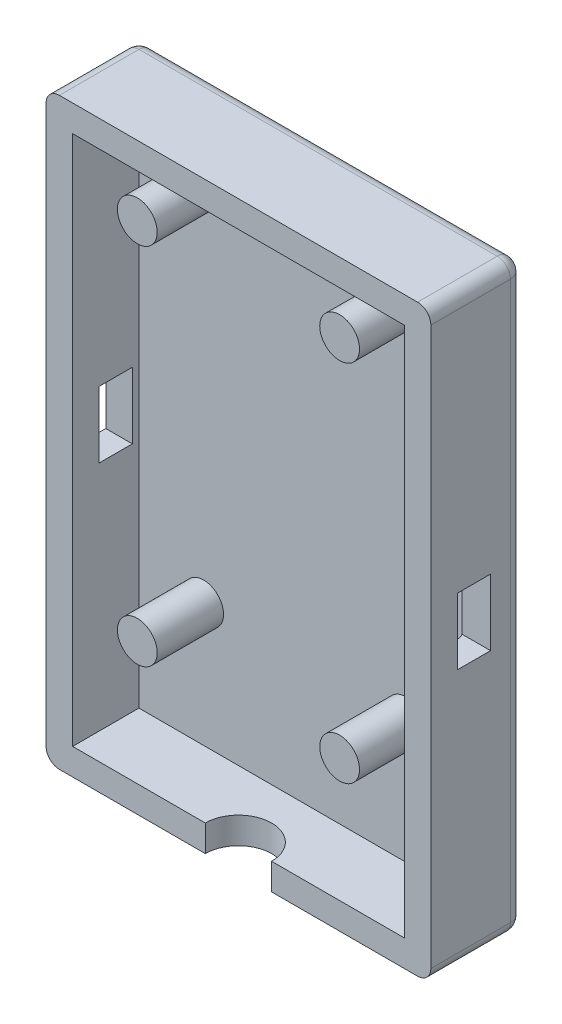
from build123d import *

# Parameters (mm, degrees)
SKETCH1_W           = 29
SKETCH1_H           = 44
BOSS_EXTRUDE1_DEPTH = 2
SKETCH2_W           = 29
SKETCH2_H           = 44
BOSS_EXTRUDE2_DEPTH = 5
CUT_EXTRUDE1_DEPTH  = 45.980551353
CUT_EXTRUDE2_DEPTH  = 39.93906297
SKETCH8_R           = 1.5
BOSS_EXTRUDE3_DEPTH = 5
FILLET1_R           = 1


with BuildPart() as part:
    # Sketch1 → Boss-Extrude1 (new body)
    with BuildSketch(Plane.XY):
        with Locations((0, 3.025)):
            Rectangle(SKETCH1_W, SKETCH1_H)
    extrude(amount=BOSS_EXTRUDE1_DEPTH)

    # Sketch2 → Boss-Extrude2 (add)
    with BuildSketch(Plane.XY.offset(2)):
        with Locations((0, 3.025)):
            Rectangle(SKETCH2_W, SKETCH2_H)
        Polygon((12.5, 23.025), (12.5, 16.975), (12.5, -16.975), (-12.5, -16.975), (-12.5, 16.975), (-12.5, 23.025), align=None, mode=Mode.SUBTRACT)
    extrude(amount=BOSS_EXTRUDE2_DEPTH)

    # Sketch4 → Cut-Extrude1 (cut, through all)
    with BuildSketch(Plane(origin=(0, -16.975, 0), x_dir=(1, 0, 0), z_dir=(0, 1, 0))):
        with BuildLine():
            Line((-2.5, -7), (2.5, -7))
            ThreePointArc((2.5, -7), (0, -4.5), (-2.5, -7))
        make_face()
    extrude(amount=-CUT_EXTRUDE1_DEPTH, mode=Mode.SUBTRACT)

    # Sketch5 → Cut-Extrude2 (cut, through all)
    with BuildSketch(Plane.ZY.offset(14.5)):
        Polygon((5, 5.525), (5, 0.525), (4.5, 0.525), (2.5, 0.525), (2.5, 5.525), (4.5, 5.525), align=None)
    extrude(amount=-CUT_EXTRUDE2_DEPTH, mode=Mode.SUBTRACT)

    # Sketch8 → Boss-Extrude3 (add)
    with BuildSketch(Plane.XY.offset(2)):
        with Locations((-7.625, 19.775)):
            Circle(SKETCH8_R)
        with Locations(Location((-7.625, -7.675, 0), (0, 0, 180))):
            Circle(SKETCH8_R)
        with Locations((7.625, -7.675)):
            Circle(SKETCH8_R)
        with Locations(Location((7.625, 19.775, 0), (0, 0, 180))):
            Circle(SKETCH8_R)
    extrude(amount=BOSS_EXTRUDE3_DEPTH)

    # Fillet1
    # the kernel refuses this fillet: 1 mm, written as the material it adds along each edge
    with BuildSketch(Plane(origin=(12.5, 23.025, 2), x_dir=(0, 0, 1), z_dir=(0, -1, 0))) as fillet1_piece_1_section:
        with BuildLine():
            CenterArc((FILLET1_R, FILLET1_R), FILLET1_R, 180, 90)
            Line((0, FILLET1_R), (0, 0))
            Line((0, 0), (FILLET1_R, 0))
        make_face()
    fillet1_piece_1 = extrude(amount=42.5, mode=Mode.PRIVATE)
    fillet1_piece_1 = split(fillet1_piece_1, bisect_by=Plane(origin=(12.460315407, 5.525, 2.623263613), z_dir=(0, 1, 0)), keep=Keep.TOP, mode=Mode.PRIVATE)
    add(fillet1_piece_1)
    with BuildSketch(Plane(origin=(12.5, 25.525, 2), x_dir=(0, 0, 1), z_dir=(0, -1, 0))) as fillet1_piece_2_section:
        with BuildLine():
            CenterArc((FILLET1_R, FILLET1_R), FILLET1_R, 180, 90)
            Line((0, FILLET1_R), (0, 0))
            Line((0, 0), (FILLET1_R, 0))
        make_face()
    fillet1_piece_2 = extrude(amount=42.5, mode=Mode.PRIVATE)
    fillet1_piece_2 = split(fillet1_piece_2, bisect_by=Plane(origin=(12.255975151, 3.025, 2.5), z_dir=(0, 0, -1)), keep=Keep.TOP, mode=Mode.PRIVATE)
    fillet1_piece_2 = split(fillet1_piece_2, bisect_by=Plane(origin=(12.255975151, 5.525, 2.17839593), z_dir=(0, -1, 0)), keep=Keep.TOP, mode=Mode.PRIVATE)
    add(fillet1_piece_2)
    with BuildSketch(Plane(origin=(12.5, 25.525, 2), x_dir=(0, 0, 1), z_dir=(0, -1, 0))) as fillet1_piece_3_section:
        with BuildLine():
            CenterArc((FILLET1_R, FILLET1_R), FILLET1_R, 180, 90)
            Line((0, FILLET1_R), (0, 0))
            Line((0, 0), (FILLET1_R, 0))
        make_face()
    fillet1_piece_3 = extrude(amount=42.5, mode=Mode.PRIVATE)
    fillet1_piece_3 = split(fillet1_piece_3, bisect_by=Plane(origin=(12.460315407, 0.525, 2.623263613), z_dir=(0, -1, 0)), keep=Keep.TOP, mode=Mode.PRIVATE)
    add(fillet1_piece_3)
    # the kernel refuses this fillet: 1 mm, written as the material it takes off along each edge
    with BuildSketch(Plane(origin=(13.5, 24.025, 1), x_dir=(0, 0, -1), z_dir=(0, 1, 0))) as fillet1_2_piece_1_section:
        Polygon((0, 0), (FILLET1_R * 1.02, 0), (FILLET1_R * 1.02, -FILLET1_R * 1.02), (0, -FILLET1_R * 1.02), align=None)
    fillet1_2_piece_1 = extrude(amount=FILLET1_R * 1.02, mode=Mode.PRIVATE)
    fillet1_2_piece_1 = fillet1_2_piece_1 - Plane(origin=(13.5, 24.025, 1), x_dir=(-0.7071067811865475, 0, 0.7071067811865475), z_dir=(0, 1, 0)) * Sphere(FILLET1_R, mode=Mode.PRIVATE)
    add(fillet1_2_piece_1, mode=Mode.SUBTRACT)
    with BuildSketch(Plane(origin=(13.5, -17.975, 1), x_dir=(1, 0, 0), z_dir=(0, 0, -1))) as fillet1_2_piece_2_section:
        Polygon((0, 0), (FILLET1_R * 1.02, 0), (FILLET1_R * 1.02, FILLET1_R * 1.02), (0, FILLET1_R * 1.02), align=None)
    fillet1_2_piece_2 = extrude(amount=FILLET1_R * 1.02, mode=Mode.PRIVATE)
    fillet1_2_piece_2 = fillet1_2_piece_2 - Plane(origin=(13.5, -17.975, 1), x_dir=(-0.7071067811865476, 0.7071067811865475, 0), z_dir=(0, 0, -1)) * Sphere(FILLET1_R, mode=Mode.PRIVATE)
    add(fillet1_2_piece_2, mode=Mode.SUBTRACT)
    with BuildSketch(Plane(origin=(-13.5, -17.975, 1), x_dir=(0, -1, 0), z_dir=(0, 0, -1))) as fillet1_2_piece_3_section:
        Polygon((0, 0), (FILLET1_R * 1.02, 0), (FILLET1_R * 1.02, FILLET1_R * 1.02), (0, FILLET1_R * 1.02), align=None)
    fillet1_2_piece_3 = extrude(amount=FILLET1_R * 1.02, mode=Mode.PRIVATE)
    fillet1_2_piece_3 = fillet1_2_piece_3 - Plane(origin=(-13.5, -17.975, 1), x_dir=(0.7071067811865475, 0.7071067811865477, 0), z_dir=(0, 0, -1)) * Sphere(FILLET1_R, mode=Mode.PRIVATE)
    add(fillet1_2_piece_3, mode=Mode.SUBTRACT)
    with BuildSketch(Plane(origin=(-13.5, 24.025, 1), x_dir=(0, 0, -1), z_dir=(0, 1, 0))) as fillet1_2_piece_4_section:
        Polygon((0, 0), (FILLET1_R * 1.02, 0), (FILLET1_R * 1.02, FILLET1_R * 1.02), (0, FILLET1_R * 1.02), align=None)
    fillet1_2_piece_4 = extrude(amount=FILLET1_R * 1.02, mode=Mode.PRIVATE)
    fillet1_2_piece_4 = fillet1_2_piece_4 - Plane(origin=(-13.5, 24.025, 1), x_dir=(0.7071067811865475, 0, 0.7071067811865475), z_dir=(0, 1, 0)) * Sphere(FILLET1_R, mode=Mode.PRIVATE)
    add(fillet1_2_piece_4, mode=Mode.SUBTRACT)
    with BuildSketch(Plane(origin=(14.5, 24.025, 0), x_dir=(-1, 0, 0), z_dir=(0, -1, 0)), Plane(origin=(-14.5, -17.975, 0), x_dir=(1, 0, 0), z_dir=(0, 1, 0))) as fillet1_2_piece_5:
        with BuildLine():
            CenterArc((FILLET1_R, -FILLET1_R), FILLET1_R, 90, 90)
            Line((0, -FILLET1_R), (0, 0))
            Line((0, 0), (FILLET1_R, 0))
        make_face()
    extrude(amount=42, mode=Mode.SUBTRACT)
    with BuildSketch(Plane(origin=(13.5, -18.975, 0), x_dir=(0, 1, 0), z_dir=(-1, 0, 0))) as fillet1_2_piece_6:
        with BuildLine():
            CenterArc((FILLET1_R, -FILLET1_R), FILLET1_R, 90, 90)
            Line((0, -FILLET1_R), (0, 0))
            Line((0, 0), (FILLET1_R, 0))
        make_face()
    extrude(amount=27, mode=Mode.SUBTRACT)
    with BuildSketch(Plane(origin=(14.5, -18.975, 9.5), x_dir=(-1, 0, 0), z_dir=(0, 0, -1)), Plane(origin=(-14.5, -18.975, 1), x_dir=(1, 0, 0), z_dir=(0, 0, 1))) as fillet1_2_piece_7:
        with BuildLine():
            CenterArc((FILLET1_R, FILLET1_R), FILLET1_R, 180, 90)
            Line((0, FILLET1_R), (0, 0))
            Line((0, 0), (FILLET1_R, 0))
        make_face()
    extrude(amount=8.5, mode=Mode.SUBTRACT)
    with BuildSketch(Plane(origin=(-14.5, 25.025, 1), x_dir=(1, 0, 0), z_dir=(0, 0, 1)), Plane(origin=(14.5, 25.025, 9.5), x_dir=(-1, 0, 0), z_dir=(0, 0, -1))) as fillet1_2_piece_8:
        with BuildLine():
            CenterArc((FILLET1_R, -FILLET1_R), FILLET1_R, 90, 90)
            Line((0, -FILLET1_R), (0, 0))
            Line((0, 0), (FILLET1_R, 0))
        make_face()
    extrude(amount=8.5, mode=Mode.SUBTRACT)
    with BuildSketch(Plane(origin=(-13.5, 25.025, 0), x_dir=(0, 0, 1), z_dir=(1, 0, 0))) as fillet1_2_piece_9:
        with BuildLine():
            CenterArc((FILLET1_R, FILLET1_R), FILLET1_R, 180, 90)
            Line((0, FILLET1_R), (0, 0))
            Line((0, 0), (FILLET1_R, 0))
        make_face()
    extrude(amount=27, mode=Mode.SUBTRACT)


solid = part.part
